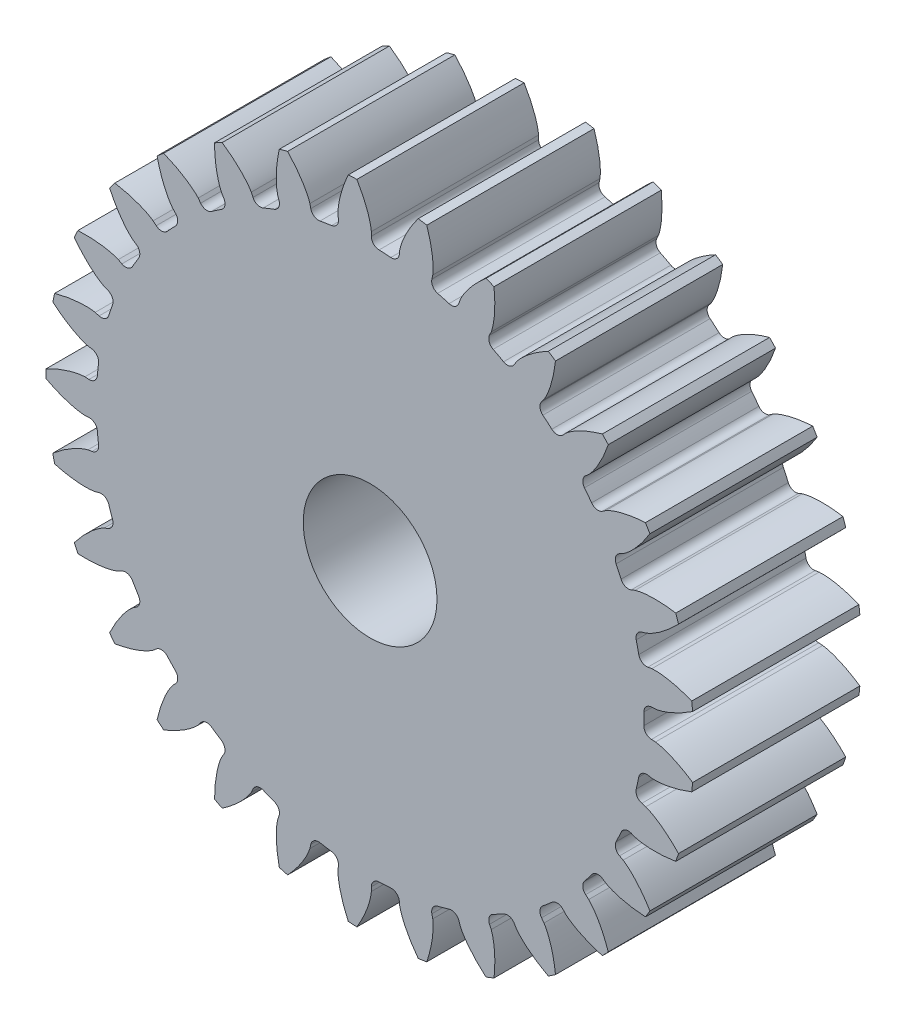
from build123d import *

# Parameters (mm, degrees)
BLANK_SKETCH_R    = 19.375
BLANK_DEPTH       = 10
TOOTH_SPACE_DEPTH = 30.168154724
TEETH_COUNT       = 29
BORE_DEPTH        = 30.157438107
BORE_DEPTH_BACK   = 30.157438107
BORE_SKETCH_R     = 4


with BuildPart() as part:
    # Blank Sketch → Blank (new body)
    with BuildSketch(Plane.XY):
        Circle(BLANK_SKETCH_R)
    extrude(amount=BLANK_DEPTH)

    # Tooth Space Sketch → Tooth Space (cut, symmetric)
    with BuildSketch(Plane.XY):
        with BuildLine():
            Line((17.066331449, 0.850286491), (16.822437533, 0.838135098))
            ThreePointArc((16.822437533, 0.838135098), (16.498428983, 0.687402436), (16.371184557, 0.353470209))
            ThreePointArc((16.371184557, 0.353470209), (16.375, 0), (16.371184557, -0.353470209))
            ThreePointArc((16.371184557, -0.353470209), (16.498428983, -0.687402436), (16.822437533, -0.838135098))
            Line((16.822437533, -0.838135098), (17.066331449, -0.850286491))
            add(Edge.make_bspline(
                [(17.066331449, -0.850286491), (17.078913275, -0.851937196), (17.107652765, -0.856186115), (17.170422542, -0.866440586), (17.241520124, -0.881451858), (17.341333053, -0.904390847), (17.442945513, -0.932165152), (17.558922709, -0.966754668), (17.67323776, -1.00492568), (17.788562436, -1.046296326), (17.901679596, -1.090080264), (18.028990433, -1.142456036), (18.182237837, -1.209787306), (18.361796427, -1.295035637), (18.564530981, -1.39907219), (18.778319306, -1.518153281), (18.986168846, -1.641618074), (19.193924058, -1.774137002), (19.392369428, -1.907028939), (19.596581156, -2.053446316), (19.78194153, -2.190924055), (19.989029254, -2.35565252), (20.150898011, -2.48714436), (20.321582435, -2.635486195), (20.401193647, -2.70595673), (20.441848473, -2.742527303)],
                knots=[0.011934507, 0.011934507, 0.011934507, 0.011934507, 0.011934507, 0.024895003, 0.042157218, 0.060774038, 0.086082242, 0.114007164, 0.141932051, 0.169856948, 0.197781854, 0.225706783, 0.253631828, 0.295826813, 0.351676579, 0.407526489, 0.463376518, 0.519226321, 0.575076233, 0.630926156, 0.686776057, 0.74262603, 0.798475955, 0.854325796, 0.910175869, 0.910175869, 0.910175869, 0.910175869, 0.910175869], degree=4))
            Line((20.441848473, -2.742527303), (20.441848473, 2.742527303))
            add(Edge.make_bspline(
                [(17.066331449, 0.850286491), (17.078913275, 0.851937196), (17.107652765, 0.856186115), (17.170422542, 0.866440586), (17.241520124, 0.881451858), (17.341333053, 0.904390847), (17.442945513, 0.932165152), (17.558922709, 0.966754668), (17.67323776, 1.00492568), (17.788562436, 1.046296326), (17.901679596, 1.090080264), (18.028990433, 1.142456036), (18.182237837, 1.209787306), (18.361796427, 1.295035637), (18.564530981, 1.39907219), (18.778319306, 1.518153281), (18.986168846, 1.641618074), (19.193924058, 1.774137002), (19.392369428, 1.907028939), (19.596581156, 2.053446316), (19.78194153, 2.190924055), (19.989029254, 2.35565252), (20.150898011, 2.48714436), (20.321582435, 2.635486195), (20.401193647, 2.70595673), (20.441848473, 2.742527303)],
                knots=[0.011934507, 0.011934507, 0.011934507, 0.011934507, 0.011934507, 0.024895003, 0.042157218, 0.060774038, 0.086082242, 0.114007164, 0.141932051, 0.169856948, 0.197781854, 0.225706783, 0.253631828, 0.295826813, 0.351676579, 0.407526489, 0.463376518, 0.519226321, 0.575076233, 0.630926156, 0.686776057, 0.74262603, 0.798475955, 0.854325796, 0.910175869, 0.910175869, 0.910175869, 0.910175869, 0.910175869], degree=4))
        make_face()
    tooth_space = extrude(amount=TOOTH_SPACE_DEPTH, both=True, mode=Mode.SUBTRACT)

    # Teeth: Tooth Space ×29 about axis
    teeth_axis = Axis((0, 0, -0.50007105), (0, 0, 1))
    for i in range(1, TEETH_COUNT):
        add(tooth_space.rotate(teeth_axis, i * 360 / TEETH_COUNT), mode=Mode.SUBTRACT)

    # Bore Sketch → Bore (cut, two sides: drawn at the far end of the back side and taken through both)
    with BuildSketch(Plane.XY.offset(-BORE_DEPTH_BACK)):
        Circle(BORE_SKETCH_R)
    extrude(amount=BORE_DEPTH + BORE_DEPTH_BACK, mode=Mode.SUBTRACT)


solid = part.part
